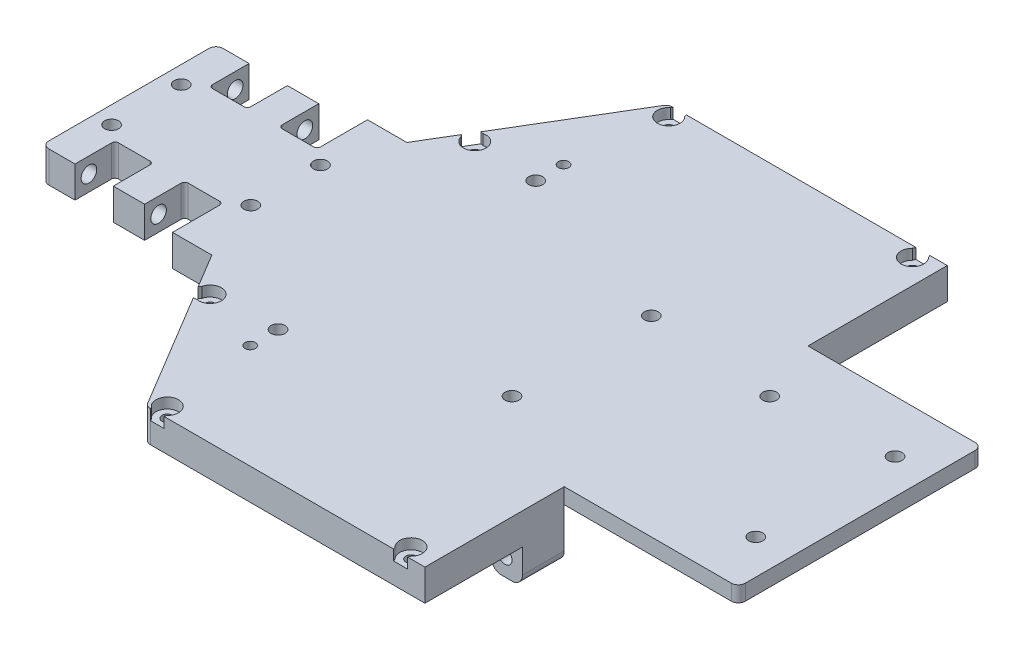
from build123d import *

# Parameters (mm, degrees)
BOSS_EXTRUDE1_DEPTH = 9
SKETCH3_R           = 2
CUT_EXTRUDE1_DEPTH  = 112.488030158
SKETCH4_W           = 70
SKETCH4_H           = 4.5
BOSS_EXTRUDE2_DEPTH = 50
SKETCH5_W           = 70
SKETCH5_H           = 4.5
CUT_EXTRUDE2_DEPTH  = 50
SKETCH6_R           = 2
CUT_EXTRUDE4_DEPTH  = 50
FILLET1_R           = 2
FILLET2_R           = 2
SKETCH7_W           = 11
SKETCH7_H           = 11.5
CUT_EXTRUDE5_DEPTH  = 153.08328408
SKETCH8_R           = 2.25
CUT_EXTRUDE6_DEPTH  = 50
SKETCH10_R          = 3.5
CUT_EXTRUDE8_DEPTH  = 4
CUT_EXTRUDE9_START  = -3
CUT_EXTRUDE9_DEPTH  = 5
FILLET6_R           = 1
SKETCH12_R          = 1.5
CUT_EXTRUDE10_DEPTH = 10
SKETCH13_R          = 3.25
CUT_EXTRUDE11_DEPTH = 3
CHAMFER1_START      = 6
CHAMFER1_DEPTH      = 4
SKETCH14_W          = 12
SKETCH14_H          = 9
BOSS_EXTRUDE3_DEPTH = 3
SKETCH15_R          = 2
CUT_EXTRUDE12_DEPTH = 152.883426671
SKETCH16_R          = 2
SKETCH16_R_2        = 1.5
CUT_EXTRUDE13_DEPTH = 10
SKETCH17_W          = 9
SKETCH17_H          = 12
BOSS_EXTRUDE4_DEPTH = 10
SKETCH18_R          = 2
CUT_EXTRUDE14_DEPTH = 5
FILLET8_R           = 3


with BuildPart() as part:
    # Sketch1 → Boss-Extrude1 (new body)
    with BuildSketch(Plane(origin=(0, 0, 0), x_dir=(1, 0, 0), z_dir=(0, 1, 0))):
        Polygon((-78.00255572, 25), (-28.00255572, 25), (1.99744428, 75), (81.99744428, 75), (81.99744428, -75), (1.99744428, -75), (-28.00255572, -25), (-78.00255572, -25), align=None)
    extrude(amount=BOSS_EXTRUDE1_DEPTH)

    # Sketch3 → Cut-Extrude1 (cut, through all)
    with BuildSketch(Plane(origin=(0, 9, 0), x_dir=(1, 0, 0), z_dir=(0, 1, 0))):
        with Locations(Location((-73.00255572, 10, 0), (0, 0, 270))):
            Circle(SKETCH3_R)
        with Locations(Location((-33.00255572, 10, 0), (0, 0, 270))):
            Circle(SKETCH3_R)
        with Locations(Location((-33.00255572, -10, 0), (0, 0, 270))):
            Circle(SKETCH3_R)
        with Locations(Location((-73.00255572, -10, 0), (0, 0, 270))):
            Circle(SKETCH3_R)
    extrude(amount=-CUT_EXTRUDE1_DEPTH, mode=Mode.SUBTRACT)

    # Sketch4 → Boss-Extrude2 (add)
    with BuildSketch(Plane(origin=(81.99744428, 0, 0), x_dir=(0, 0, -1), z_dir=(1, 0, 0))):
        with Locations((0, 6.75)):
            Rectangle(SKETCH4_W, SKETCH4_H)
    extrude(amount=BOSS_EXTRUDE2_DEPTH)

    # Sketch5 → Cut-Extrude2 (cut)
    with BuildSketch(Plane(origin=(81.99744428, 0, 0), x_dir=(0, 0, -1), z_dir=(1, 0, 0))):
        with Locations((0, 2.25)):
            Rectangle(SKETCH5_W, SKETCH5_H)
    extrude(amount=-CUT_EXTRUDE2_DEPTH, mode=Mode.SUBTRACT)

    # Sketch6 → Cut-Extrude4 (cut)
    with BuildSketch(Plane(origin=(0, 9, 0), x_dir=(1, 0, 0), z_dir=(0, 1, 0))):
        with Locations(Location((51.99744428, 20, 0), (0, 0, 270))):
            Circle(SKETCH6_R)
        with Locations(Location((51.99744428, -20, 0), (0, 0, 270))):
            Circle(SKETCH6_R)
        with Locations(Location((121.99744428, 20, 0), (0, 0, 270))):
            Circle(SKETCH6_R)
        with Locations(Location((121.99744428, -20, 0), (0, 0, 270))):
            Circle(SKETCH6_R)
    extrude(amount=-CUT_EXTRUDE4_DEPTH, mode=Mode.SUBTRACT)

    # Fillet1
    fillet1_edges = [part.edges().sort_by_distance(p)[0] for p in [
        (1.99744428, 4.5, 75),
        (-28.00255572, 4.5, 25),
        (-78.00255572, 4.5, 25),
        (-78.00255572, 4.5, -25),
        (-28.00255572, 4.5, -25),
        (1.99744428, 4.5, -75),
    ]]
    fillet(fillet1_edges, radius=FILLET1_R)

    # Fillet2
    fillet2_edges = [part.edges().sort_by_distance(p)[0] for p in [
        (131.99744428, 6.75, 35),
        (131.99744428, 6.75, -35),
    ]]
    fillet(fillet2_edges, radius=FILLET2_R)

    # Sketch7 → Cut-Extrude5 (cut, through all)
    with BuildSketch(Plane(origin=(0, 9, 0), x_dir=(1, 0, 0), z_dir=(0, 1, 0))):
        with Locations((-63.00255572, -19.25)):
            Rectangle(SKETCH7_W, SKETCH7_H)
        with Locations((-43.00255572, -19.25)):
            Rectangle(SKETCH7_W, SKETCH7_H)
    cut_extrude5 = extrude(amount=-CUT_EXTRUDE5_DEPTH, mode=Mode.SUBTRACT)

    # Sketch8 → Cut-Extrude6 (cut)
    with BuildSketch(Plane.ZY.offset(78.00255572)):
        with Locations((21, 4.5)):
            Circle(SKETCH8_R)
    cut_extrude6 = extrude(amount=-CUT_EXTRUDE6_DEPTH, mode=Mode.SUBTRACT)

    # Sketch10 → Cut-Extrude8 (cut)
    with BuildSketch(Plane.ZY.offset(78.00255572)):
        with Locations((21, 4.5)):
            Circle(SKETCH10_R)
    cut_extrude8 = extrude(amount=-CUT_EXTRUDE8_DEPTH, mode=Mode.SUBTRACT)

    # Sketch11 → Cut-Extrude9 (cut)
    with BuildSketch(Plane.ZY.offset(37.50255572).offset(CUT_EXTRUDE9_START)):
        Polygon((16.958548116, 4.5), (16.958548116, -3.067772958), (25.041451884, -3.067772958), (25.041451884, 4.5), (23.020725942, 8), (18.979274058, 8), align=None)
    cut_extrude9 = extrude(amount=-CUT_EXTRUDE9_DEPTH, mode=Mode.SUBTRACT)

    # Mirror8: Cut-Extrude5, Cut-Extrude6, Cut-Extrude8, Cut-Extrude9 across plane
    add(cut_extrude5.mirror(Plane.XY), mode=Mode.SUBTRACT)
    add(cut_extrude6.mirror(Plane.XY), mode=Mode.SUBTRACT)
    add(cut_extrude8.mirror(Plane.XY), mode=Mode.SUBTRACT)
    add(cut_extrude9.mirror(Plane.XY), mode=Mode.SUBTRACT)

    # Fillet6
    fillet6_edges = [part.edges().sort_by_distance(p)[0] for p in [
        (-68.50255572, 4.5, 13.5),
        (-57.50255572, 4.5, 13.5),
        (-48.50255572, 4.5, 13.5),
        (-37.50255572, 4.5, 13.5),
        (-68.50255572, 4.5, -13.5),
        (-57.50255572, 4.5, -13.5),
        (-48.50255572, 4.5, -13.5),
        (-37.50255572, 4.5, -13.5),
    ]]
    fillet(fillet6_edges, radius=FILLET6_R)

    # Sketch12 → Cut-Extrude10 (cut)
    with BuildSketch(Plane.XZ):
        with Locations(Location((4.99744428, 72, 0), (0, 0, 270))):
            Circle(SKETCH12_R)
        with Locations(Location((74.99744428, 72, 0), (0, 0, 270))):
            Circle(SKETCH12_R)
        with Locations(Location((-16.703984583, 38, 0), (0, 0, 270))):
            Circle(SKETCH12_R)
        with Locations(Location((-16.703984583, -38, 0), (0, 0, 90))):
            Circle(SKETCH12_R)
        with Locations(Location((74.99744428, -72, 0), (0, 0, 90))):
            Circle(SKETCH12_R)
        with Locations(Location((4.99744428, -72, 0), (0, 0, 90))):
            Circle(SKETCH12_R)
    extrude(amount=-CUT_EXTRUDE10_DEPTH, mode=Mode.SUBTRACT)

    # Sketch13 → Cut-Extrude11 (cut)
    with BuildSketch(Plane(origin=(0, 9, 0), x_dir=(1, 0, 0), z_dir=(0, 1, 0))):
        with Locations((-16.703984583, 38)):
            Circle(SKETCH13_R)
        with Locations((4.99744428, 72)):
            Circle(SKETCH13_R)
        with Locations((74.99744428, 72)):
            Circle(SKETCH13_R)
        with Locations((74.99744428, -72)):
            Circle(SKETCH13_R)
        with Locations((4.99744428, -72)):
            Circle(SKETCH13_R)
        with Locations((-16.703984583, -38)):
            Circle(SKETCH13_R)
    extrude(amount=-CUT_EXTRUDE11_DEPTH, mode=Mode.SUBTRACT)

    # Chamfer1: read off the stored shape, not the designer's step
    # Chamfer1 outline → Chamfer1 (cut)
    with BuildSketch(Plane(origin=(0, 0, 0), x_dir=(1, 0, 0), z_dir=(0, 1, 0)).offset(CHAMFER1_START)):
        with BuildLine():
            ThreePointArc((76.24744428, 75), (76.81151853, 74.696596858), (77.305136588, 74.288461538))
            Line((77.305136588, 74.288461538), (77.012150163, 75))
            Line((77.012150163, 75), (76.24744428, 75))
        make_face()
        with BuildLine():
            Line((7.305136588, 74.288461538), (7.012150163, 75))
            Line((7.012150163, 75), (6.24744428, 75))
            ThreePointArc((6.24744428, 75), (6.81151853, 74.696596858), (7.305136588, 74.288461538))
        make_face()
        with BuildLine():
            Line((72.982738398, 75), (72.689751972, 74.288461538))
            ThreePointArc((72.689751972, 74.288461538), (73.18337003, 74.696596858), (73.74744428, 75))
            Line((73.74744428, 75), (72.982738398, 75))
        make_face()
        with BuildLine():
            Line((3.24843319, 75), (2.994690649, 74.559585492))
            ThreePointArc((2.994690649, 74.559585492), (3.35622742, 74.805157254), (3.74744428, 75))
            Line((3.74744428, 75), (3.24843319, 75))
        make_face()
        with BuildLine():
            Line((-20.313020985, 37.815891225), (-19.85362206, 37.198573919))
            ThreePointArc((-19.85362206, 37.198573919), (-19.949630814, 37.831831801), (-19.919583054, 38.471621109))
            Line((-19.919583054, 38.471621109), (-20.313020985, 37.815891225))
        make_face()
        with BuildLine():
            ThreePointArc((-18.633343666, 40.615353423), (-18.082963811, 40.942943473), (-17.479026266, 41.156233576))
            Line((-17.479026266, 41.156233576), (-18.239905735, 41.271083308))
            Line((-18.239905735, 41.271083308), (-18.633343666, 40.615353423))
        make_face()
        with BuildLine():
            Line((6.24744428, -75), (7.012150163, -75))
            Line((7.012150163, -75), (7.305136588, -74.288461538))
            ThreePointArc((7.305136588, -74.288461538), (6.81151853, -74.696596858), (6.24744428, -75))
        make_face()
        with BuildLine():
            Line((77.012150163, -75), (77.305136588, -74.288461538))
            ThreePointArc((77.305136588, -74.288461538), (76.81151853, -74.696596858), (76.24744428, -75))
            Line((76.24744428, -75), (77.012150163, -75))
        make_face()
        with BuildLine():
            ThreePointArc((73.74744428, -75), (73.18337003, -74.696596858), (72.689751972, -74.288461538))
            Line((72.689751972, -74.288461538), (72.982738398, -75))
            Line((72.982738398, -75), (73.74744428, -75))
        make_face()
        with BuildLine():
            ThreePointArc((3.74744428, -75), (3.35622742, -74.805157254), (2.994690649, -74.559585492))
            Line((2.994690649, -74.559585492), (3.24843319, -75))
            Line((3.24843319, -75), (3.74744428, -75))
        make_face()
        with BuildLine():
            Line((-18.239905735, -41.271083308), (-17.479026266, -41.156233576))
            ThreePointArc((-17.479026266, -41.156233576), (-18.082963811, -40.942943473), (-18.633343666, -40.615353423))
            Line((-18.633343666, -40.615353423), (-18.239905735, -41.271083308))
        make_face()
        with BuildLine():
            ThreePointArc((-19.919583054, -38.471621109), (-19.949630814, -37.831831801), (-19.85362206, -37.198573919))
            Line((-19.85362206, -37.198573919), (-20.313020985, -37.815891225))
            Line((-20.313020985, -37.815891225), (-19.919583054, -38.471621109))
        make_face()
    extrude(amount=CHAMFER1_DEPTH, mode=Mode.SUBTRACT)

    # Sketch14 → Boss-Extrude3 (add)
    with BuildSketch(Plane.XY.offset(25)):
        with Locations((-31.50255572, 4.5)):
            Rectangle(SKETCH14_W, SKETCH14_H)
    boss_extrude3 = extrude(amount=BOSS_EXTRUDE3_DEPTH)

    # Mirror10: Boss-Extrude3 across plane
    add(boss_extrude3.mirror(Plane.XY))

    # Sketch15 → Cut-Extrude12 (cut, through all)
    with BuildSketch(Plane.XZ.offset(-4.5)):
        with Locations(Location((88.99744428, -17, 0), (0, 0, 270))):
            Circle(SKETCH15_R)
    extrude(amount=-CUT_EXTRUDE12_DEPTH, mode=Mode.SUBTRACT)

    # Sketch16 → Cut-Extrude13 (cut)
    with BuildSketch(Plane.XZ):
        with Locations(Location((1.79744428, -37, 0), (0, 0, 270))):
            Circle(SKETCH16_R)
        with Locations(Location((1.79744428, -45, 0), (0, 0, 270))):
            Circle(SKETCH16_R_2)
        with Locations(Location((1.79744428, 45, 0), (0, 0, 90))):
            Circle(SKETCH16_R_2)
        with Locations(Location((1.79744428, 37, 0), (0, 0, 90))):
            Circle(SKETCH16_R)
    extrude(amount=-CUT_EXTRUDE13_DEPTH, mode=Mode.SUBTRACT)

    # Sketch17 → Boss-Extrude4 (add)
    with BuildSketch(Plane.XZ):
        with Locations((27.49744428, 41)):
            Rectangle(SKETCH17_W, SKETCH17_H)
        with Locations((77.49744428, 41)):
            Rectangle(SKETCH17_W, SKETCH17_H)
    extrude(amount=BOSS_EXTRUDE4_DEPTH)

    # Sketch18 → Cut-Extrude14 (cut)
    with BuildSketch(Plane.XY.offset(47)):
        with Locations((27.99744428, -4.816681728)):
            Circle(SKETCH18_R)
        with Locations((76.99744428, -4.816681728)):
            Circle(SKETCH18_R)
    extrude(amount=-CUT_EXTRUDE14_DEPTH, mode=Mode.SUBTRACT)

    # Fillet8
    # the kernel refuses this fillet: 3 mm, written as the material it adds along each edge
    with BuildSketch(Plane(origin=(22.99744428, 0, 35), x_dir=(-1, 0, 0), z_dir=(0, 0, 1))) as fillet8_piece_1:
        with BuildLine():
            CenterArc((FILLET8_R, FILLET8_R), FILLET8_R, 180, 90)
            Line((0, FILLET8_R), (0, 0))
            Line((0, 0), (FILLET8_R, 0))
        make_face()
    extrude(amount=12)
    with BuildSketch(Plane(origin=(31.99744428, 0, 35), x_dir=(0, 0, -1), z_dir=(-1, 0, 0))) as fillet8_piece_2:
        with BuildLine():
            CenterArc((FILLET8_R, FILLET8_R), FILLET8_R, 180, 90)
            Line((0, FILLET8_R), (0, 0))
            Line((0, 0), (FILLET8_R, 0))
        make_face()
    extrude(amount=9)
    with BuildSketch(Plane(origin=(22.99744428, 0, 27.5), x_dir=(-1, 0, 0), z_dir=(0, 0, 1))) as fillet8_piece_3a_section:
        with BuildLine():
            CenterArc((FILLET8_R, FILLET8_R), FILLET8_R, 180, 90)
            Line((0, FILLET8_R), (0, 0))
            Line((0, 0), (FILLET8_R, 0))
        make_face()
    fillet8_piece_3a = extrude(amount=19.5, mode=Mode.PRIVATE)
    fillet8_piece_3a = split(fillet8_piece_3a, bisect_by=Plane(origin=(22.99744428, 0, 35), z_dir=(0, 0, -1)), keep=Keep.TOP, mode=Mode.PRIVATE)
    with BuildSketch(Plane(origin=(31.99744428, 0, 35), x_dir=(0, 0, -1), z_dir=(-1, 0, 0))) as fillet8_piece_3b_section:
        with BuildLine():
            CenterArc((FILLET8_R, FILLET8_R), FILLET8_R, 180, 90)
            Line((0, FILLET8_R), (0, 0))
            Line((0, 0), (FILLET8_R, 0))
        make_face()
    fillet8_piece_3b = extrude(amount=16.5, mode=Mode.PRIVATE)
    fillet8_piece_3b = split(fillet8_piece_3b, bisect_by=Plane(origin=(22.99744428, 0, 35), z_dir=(-1, 0, 0)), keep=Keep.TOP, mode=Mode.PRIVATE)
    fillet8_piece_3 = fillet8_piece_3a & fillet8_piece_3b
    add(fillet8_piece_3)
    # the kernel refuses this fillet: 3 mm, written as the material it takes off along each edge
    with BuildSketch(Plane(origin=(22.99744428, -10, 27.5), x_dir=(1, 0, 0), z_dir=(0, 0, 1)), Plane(origin=(31.99744428, -10, 54.5), x_dir=(-1, 0, 0), z_dir=(0, 0, -1)), Plane(origin=(72.99744428, -10, 27.5), x_dir=(1, 0, 0), z_dir=(0, 0, 1)), Plane(origin=(81.99744428, -10, 54.5), x_dir=(-1, 0, 0), z_dir=(0, 0, -1))) as fillet8_2_piece_1:
        with BuildLine():
            CenterArc((FILLET8_R, FILLET8_R), FILLET8_R, 180, 90)
            Line((0, FILLET8_R), (0, 0))
            Line((0, 0), (FILLET8_R, 0))
        make_face()
    extrude(amount=27, mode=Mode.SUBTRACT)


solid = part.part
